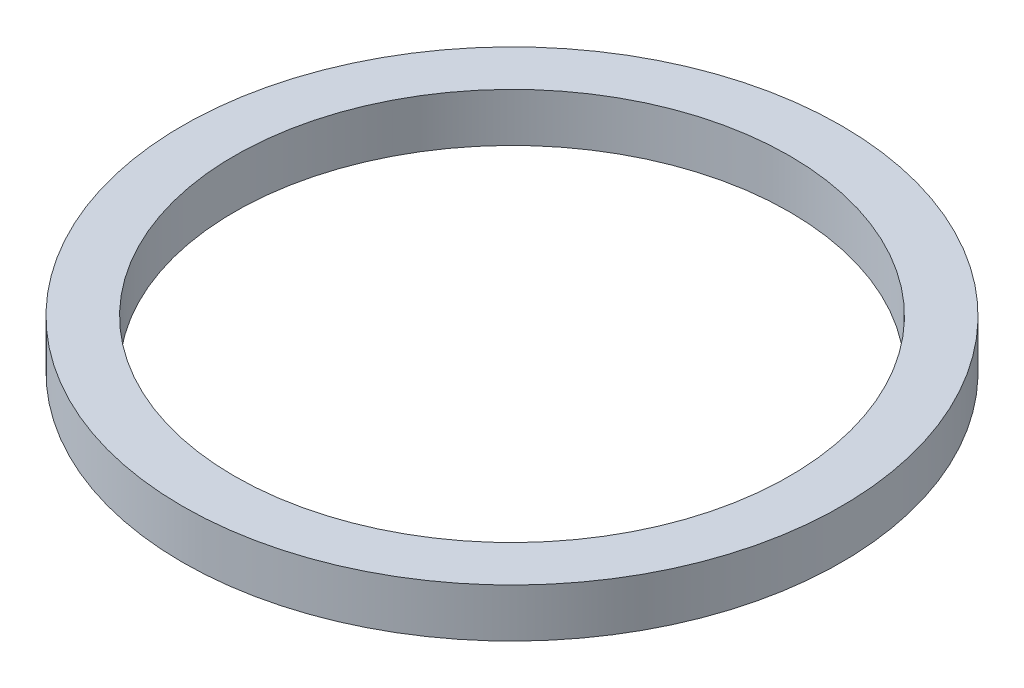
from build123d import *

# Parameters (mm, degrees)
SKETCH1_R           = 47.5
BOSS_EXTRUDE1_DEPTH = 7
SKETCH2_R           = 40
CUT_EXTRUDE1_DEPTH  = 68.538877693


with BuildPart() as part:
    # Sketch1 → Boss-Extrude1 (new body)
    with BuildSketch(Plane(origin=(0, 0, 0), x_dir=(1, 0, 0), z_dir=(0, 1, 0))):
        Circle(SKETCH1_R)
    extrude(amount=BOSS_EXTRUDE1_DEPTH)

    # Sketch2 → Cut-Extrude1 (cut, through all)
    with BuildSketch(Plane(origin=(0, 0, 0), x_dir=(1, 0, 0), z_dir=(0, 1, 0))):
        Circle(SKETCH2_R)
    extrude(amount=CUT_EXTRUDE1_DEPTH, mode=Mode.SUBTRACT)


solid = part.part
